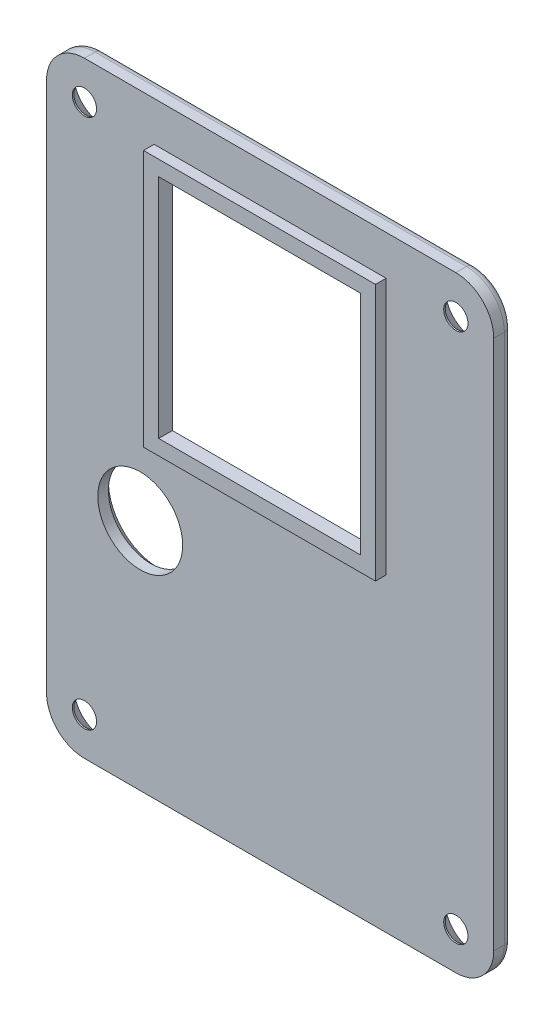
from build123d import *

# Parameters (mm, degrees)
SKETCH_1_W           = 59
SKETCH_1_H           = 80
SKETCH_1_R           = 5.6
EXTRUDE_1_DEPTH      = 2.4
SKETCH_4_W           = 59
SKETCH_4_H           = 80
EXTRUDE_6_DEPTH      = 5.5
FILLET_1_R           = 5
FILLET_2_R           = 5
SKETCH_14_R          = 3
SKETCH_14_R_2        = 1.3
EXTRUDE_7_DEPTH      = 6.5
EXTRUDE_10_DEPTH     = 1
FILLET_3_R           = 1
CUT_EXTRUDE_1_DEPTH  = 10
SKETCH_23_W          = 26.6
SKETCH_23_H          = 29.9
CUT_EXTRUDE_4_DEPTH  = 52
SKETCH_24_W          = 26.6
SKETCH_24_H          = 5
EXTRUDE_11_DEPTH     = 0.2
SKETCH_25_W          = 26.6
SKETCH_25_H          = 5
EXTRUDE_12_DEPTH     = 0.2
SKETCH_26_R          = 3.14740537
SKETCH_26_R_2        = 1.3
EXTRUDE_13_DEPTH     = 6.5
CUT_EXTRUDE_5_DEPTH  = 0.6
CHAMFER_1_SIZE       = 2
CHAMFER_2_SIZE       = 1
EXTRUDE_16_DEPTH     = 6.5
EXTRUDE_16_2_DEPTH   = 6.5
EXTRUDE_16_3_DEPTH   = 6.5
EXTRUDE_16_4_DEPTH   = 6.5
EXTRUDE_16_5_DEPTH   = 6.5
EXTRUDE_16_6_DEPTH   = 6.5
EXTRUDE_17_REACH     = 101.616
SKETCH_34_R          = 1.3
CUT_EXTRUDE_7_DEPTH  = 10
SKETCH_33_W          = 70.771509838
SKETCH_33_H          = 90.701063175
CUT_EXTRUDE_6_DEPTH  = 10
CHAMFER_3_SIZE       = 2.5
SKETCH_35_W          = 30.6
SKETCH_35_H          = 33.9
SKETCH_35_W_2        = 26.6
SKETCH_35_H_2        = 29.9
EXTRUDE_18_DEPTH     = 1.4
SKETCH_37_R          = 1.6
CUT_EXTRUDE_11_DEPTH = 11.4


with BuildPart() as part:
    # Эскиз1 → Бобышка-Вытянуть1 (new body)
    with BuildSketch(Plane.XY):
        with Locations((29.5, -40)):
            Rectangle(SKETCH_1_W, SKETCH_1_H)
        with Locations((12.36, -49.17)):
            Circle(SKETCH_1_R, mode=Mode.SUBTRACT)
    extrude(amount=EXTRUDE_1_DEPTH)

    # Эскиз4 → Бобышка-Вытянуть6 (add)
    with BuildSketch(Plane.XY.offset(2.4)):
        with Locations((29.5, -40)):
            Rectangle(SKETCH_4_W, SKETCH_4_H)
        with BuildLine():
            Line((5.1, -2), (53.9, -2))
            ThreePointArc((53.9, -2), (56.092031022, -2.907968978), (57, -5.1))
            Line((57, -5.1), (57, -74.9))
            ThreePointArc((57, -74.9), (56.092031022, -77.092031022), (53.9, -78))
            Line((53.9, -78), (5.1, -78))
            ThreePointArc((5.1, -78), (2.907968978, -77.092031022), (2, -74.9))
            Line((2, -74.9), (2, -5.1))
            ThreePointArc((2, -5.1), (2.907968978, -2.907968978), (5.1, -2))
        make_face(mode=Mode.SUBTRACT)
    extrude(amount=EXTRUDE_6_DEPTH)

    # Скругление1
    fillet_1_edges = [part.edges().sort_by_distance(p)[0] for p in [
        (0, 0, 3.95),
    ]]
    fillet(fillet_1_edges, radius=FILLET_1_R)

    # Скругление2
    fillet_2_edges = [part.edges().sort_by_distance(p)[0] for p in [
        (59, 0, 3.95),
        (59, -80, 3.95),
        (0, -80, 3.95),
    ]]
    fillet(fillet_2_edges, radius=FILLET_2_R)

    # Эскиз14 → Бобышка-Вытянуть7 (add)
    # profile 1 of 4: a face of its own
    with BuildSketch(Plane.XY.offset(2.4)):
        with Locations(Location((5, -5, 0), (0, 0, 180.947144451))):
            Circle(SKETCH_14_R)
        with Locations(Location((5, -5, 0), (0, 0, 180))):
            Circle(SKETCH_14_R_2, mode=Mode.SUBTRACT)
    # profile 2 of 4: a face of its own
    with BuildSketch(Plane.XY.offset(2.4)):
        with Locations(Location((5, -75, 0), (0, 0, 179.052855549))):
            Circle(SKETCH_14_R)
        with Locations(Location((5, -75, 0), (0, 0, 180))):
            Circle(SKETCH_14_R_2, mode=Mode.SUBTRACT)
    # profile 3 of 4: a face of its own
    with BuildSketch(Plane.XY.offset(2.4)):
        with Locations(Location((54, -75, 0), (0, 0, 269.052855549))):
            Circle(SKETCH_14_R)
        with Locations(Location((54, -75, 0), (0, 0, 180))):
            Circle(SKETCH_14_R_2, mode=Mode.SUBTRACT)
    # profile 4 of 4: a face of its own
    with BuildSketch(Plane.XY.offset(2.4)):
        with Locations(Location((54, -5, 0), (0, 0, 90.947144451))):
            Circle(SKETCH_14_R)
        with Locations(Location((54, -5, 0), (0, 0, 180))):
            Circle(SKETCH_14_R_2, mode=Mode.SUBTRACT)
    extrude(amount=EXTRUDE_7_DEPTH)

    # Скругление3
    fillet_3_edges = [part.edges().sort_by_distance(p)[0] for p in [
        (0, -40, 0),
        (1.464466094, -1.464466094, 0),
        (29.5, -80, 0),
        (29.5, 0, 0),
        (59, -40, 0),
        (57.535533906, -1.464466094, 0),
        (57.535533906, -78.535533906, 0),
        (1.464466094, -78.535533906, 0),
    ]]
    fillet(fillet_3_edges, radius=FILLET_3_R)


with BuildPart() as body_2:
    # Эскиз15 → Бобышка-Вытянуть10 (new body)
    with BuildSketch(Plane.XY.offset(7.9)):
        with BuildLine():
            Line((5, 0), (54, 0))
            ThreePointArc((54, 0), (57.535533906, -1.464466094), (59, -5))
            Line((59, -5), (59, -75))
            ThreePointArc((59, -75), (57.535533906, -78.535533906), (54, -80))
            Line((54, -80), (5, -80))
            ThreePointArc((5, -80), (1.464466094, -78.535533906), (0, -75))
            Line((0, -75), (0, -5))
            ThreePointArc((0, -5), (1.464466094, -1.464466094), (5, 0))
        make_face()
        with BuildLine():
            Line((5, -1), (54, -1))
            ThreePointArc((54, -1), (56.828427125, -2.171572875), (58, -5))
            Line((58, -5), (58, -75))
            ThreePointArc((58, -75), (56.828427125, -77.828427125), (54, -79))
            Line((54, -79), (5, -79))
            ThreePointArc((5, -79), (2.171572875, -77.828427125), (1, -75))
            Line((1, -75), (1, -5))
            ThreePointArc((1, -5), (2.171572875, -2.171572875), (5, -1))
        make_face(mode=Mode.SUBTRACT)
    extrude(amount=EXTRUDE_10_DEPTH)


with BuildPart() as cut_extrude_1_tool:
    # Эскиз20 → Вырез-Вытянуть1 (new body)
    with BuildSketch(Plane(origin=(59, 0, 0), x_dir=(0, 0, -1), z_dir=(1, 0, 0))):
        with BuildLine():
            Line((-8.9, -11.15), (-5.2, -11.15))
            ThreePointArc((-5.2, -11.15), (-4.492893219, -11.442893219), (-4.2, -12.15))
            Line((-4.2, -12.15), (-4.2, -18.25))
            ThreePointArc((-4.2, -18.25), (-4.492893219, -18.957106781), (-5.2, -19.25))
            Line((-5.2, -19.25), (-8.9, -19.25))
            Line((-8.9, -19.25), (-8.9, -11.15))
        make_face()
    extrude(amount=-CUT_EXTRUDE_1_DEPTH)


with BuildPart() as part_1:
    add(part.part)

    # Вырез-Вытянуть1: cut by cut_extrude_1_tool
    add(cut_extrude_1_tool.part, mode=Mode.SUBTRACT)

    # Эскиз23 → Вырез-Вытянуть4 (cut)
    with BuildSketch(Plane(origin=(0, 0, 0), x_dir=(-1, 0, 0), z_dir=(0, 0, -1))):
        with Locations((-29.500023272, -22.190991649)):
            Rectangle(SKETCH_23_W, SKETCH_23_H)
    extrude(amount=-CUT_EXTRUDE_4_DEPTH, mode=Mode.SUBTRACT)

    # Эскиз24 → Бобышка-Вытянуть11 (add)
    with BuildSketch(Plane.XY.offset(2.4)):
        with Locations((29.500023272, -4.740991649)):
            Rectangle(SKETCH_24_W, SKETCH_24_H)
    extrude(amount=EXTRUDE_11_DEPTH)

    # Эскиз25 → Бобышка-Вытянуть12 (add)
    with BuildSketch(Plane.XY.offset(2.4)):
        with Locations((29.500023272, -39.640991649)):
            Rectangle(SKETCH_25_W, SKETCH_25_H)
    extrude(amount=EXTRUDE_12_DEPTH)


with BuildPart() as body_2_1:
    add(body_2.part)

    # Вырез-Вытянуть1: cut by cut_extrude_1_tool
    add(cut_extrude_1_tool.part, mode=Mode.SUBTRACT)


    add(part_1.part)  # Бобышка-Вытянуть13 merges part
    # Эскиз26 → Бобышка-Вытянуть13 (add)
    with BuildSketch(Plane.XY.offset(2.4)):
        with Locations(Location((46.9, -5.7, 0), (0, 0, 180))):
            Circle(SKETCH_26_R)
        with Locations(Location((46.9, -5.7, 0), (0, 0, 180))):
            Circle(SKETCH_26_R_2, mode=Mode.SUBTRACT)
    extrude(amount=EXTRUDE_13_DEPTH)

    # Эскиз27 → Вырез-Вытянуть5 (cut)
    with BuildSketch(Plane.XY.offset(7.9)):
        with BuildLine():
            Line((58, -75), (58, -19.25))
            Line((58, -19.25), (57, -19.25))
            Line((57, -19.25), (57, -74.9))
            ThreePointArc((57, -74.9), (56.999897526, -74.925205779), (56.999590109, -74.950409891))
            ThreePointArc((56.999590109, -74.950409891), (56.121320344, -77.121320344), (53.950409891, -77.999590109))
            ThreePointArc((53.950409891, -77.999590109), (53.925205779, -77.999897526), (53.9, -78))
            Line((53.9, -78), (5.1, -78))
            ThreePointArc((5.1, -78), (5.074794221, -77.999897526), (5.049590109, -77.999590109))
            ThreePointArc((5.049590109, -77.999590109), (2.878679656, -77.121320344), (2.000409891, -74.950409891))
            ThreePointArc((2.000409891, -74.950409891), (2.000102474, -74.925205779), (2, -74.9))
            Line((2, -74.9), (2, -5.1))
            ThreePointArc((2, -5.1), (2.000102474, -5.074794221), (2.000409891, -5.049590109))
            ThreePointArc((2.000409891, -5.049590109), (2.878679656, -2.878679656), (5.049590109, -2.000409891))
            ThreePointArc((5.049590109, -2.000409891), (5.074794221, -2.000102474), (5.1, -2))
            Line((5.1, -2), (53.9, -2))
            ThreePointArc((53.9, -2), (53.925205779, -2.000102474), (53.950409891, -2.000409891))
            ThreePointArc((53.950409891, -2.000409891), (56.121320344, -2.878679656), (56.999590109, -5.049590109))
            ThreePointArc((56.999590109, -5.049590109), (56.999897526, -5.074794221), (57, -5.1))
            Line((57, -5.1), (57, -11.15))
            Line((57, -11.15), (58, -11.15))
            Line((58, -11.15), (58, -5))
            ThreePointArc((58, -5), (56.828427125, -2.171572875), (54, -1))
            Line((54, -1), (5, -1))
            ThreePointArc((5, -1), (2.171572875, -2.171572875), (1, -5))
            Line((1, -5), (1, -75))
            ThreePointArc((1, -75), (2.171572875, -77.828427125), (5, -79))
            Line((5, -79), (54, -79))
            ThreePointArc((54, -79), (56.828427125, -77.828427125), (58, -75))
        make_face()
    extrude(amount=-CUT_EXTRUDE_5_DEPTH, mode=Mode.SUBTRACT)

    # Фаска1
    chamfer_1_edges = [body_2_1.edges().sort_by_distance(p)[0] for p in [
        (16.200023272, -22.190991649, 0),
        (29.500023272, -37.140991649, 0),
        (42.800023272, -22.190991649, 0),
        (29.500023272, -7.240991649, 0),
    ]]
    chamfer(chamfer_1_edges, length=CHAMFER_1_SIZE)

    # Фаска2
    chamfer_2_edges = [body_2_1.edges().sort_by_distance(p)[0] for p in [
        (6.76, -49.17, 0),
    ]]
    chamfer(chamfer_2_edges, length=CHAMFER_2_SIZE)

    # Бобышка-Вытянуть17: up to this face of the body (flat: up to its plane)
    extrude_17_end = Plane(body_2_1.part.faces().sort_by_distance((49.958383303, -5.7, 8.9))[0])
    # Эскиз31 → Бобышка-Вытянуть17 (add, up to the picked face)
    with BuildSketch(Plane.XY.offset(2.4), mode=Mode.PRIVATE) as extrude_17_sk1:
        Polygon((5, -2), (8, -2), (8, -5), align=None)
    extrude_17_tool1 = split(extrude(extrude_17_sk1.sketch, amount=EXTRUDE_17_REACH, mode=Mode.PRIVATE), bisect_by=extrude_17_end, keep=Keep.BOTH, mode=Mode.PRIVATE)
    # Эскиз31 → Бобышка-Вытянуть17 (add, up to the picked face)
    with BuildSketch(Plane.XY.offset(2.4), mode=Mode.PRIVATE) as extrude_17_sk2:
        Polygon((5, -8), (2, -8), (2, -5.1), align=None)
    extrude_17_tool2 = split(extrude(extrude_17_sk2.sketch, amount=EXTRUDE_17_REACH, mode=Mode.PRIVATE), bisect_by=extrude_17_end, keep=Keep.BOTH, mode=Mode.PRIVATE)
    # Эскиз31 → Бобышка-Вытянуть17 (add, up to the picked face)
    with BuildSketch(Plane.XY.offset(2.4), mode=Mode.PRIVATE) as extrude_17_sk3:
        Polygon((50.04740537, -5.7), (50.04740537, -2), (43.75259463, -2), (43.753891914, -5.790357503), (46.9, -2.55259463), align=None)
    extrude_17_tool3 = split(extrude(extrude_17_sk3.sketch, amount=EXTRUDE_17_REACH, mode=Mode.PRIVATE), bisect_by=extrude_17_end, keep=Keep.BOTH, mode=Mode.PRIVATE)
    # Эскиз31 → Бобышка-Вытянуть17 (add, up to the picked face)
    with BuildSketch(Plane.XY.offset(2.4), mode=Mode.PRIVATE) as extrude_17_sk4:
        Polygon((57, -5), (54, -8), (57, -8), align=None)
    extrude_17_tool4 = split(extrude(extrude_17_sk4.sketch, amount=EXTRUDE_17_REACH, mode=Mode.PRIVATE), bisect_by=extrude_17_end, keep=Keep.BOTH, mode=Mode.PRIVATE)
    # Эскиз31 → Бобышка-Вытянуть17 (add, up to the picked face)
    with BuildSketch(Plane.XY.offset(2.4), mode=Mode.PRIVATE) as extrude_17_sk5:
        Polygon((54, -2), (51, -2), (51, -5), align=None)
    extrude_17_tool5 = split(extrude(extrude_17_sk5.sketch, amount=EXTRUDE_17_REACH, mode=Mode.PRIVATE), bisect_by=extrude_17_end, keep=Keep.BOTH, mode=Mode.PRIVATE)
    add(extrude_17_tool1.solids().sort_by(Axis((7, -3, 2.4), (0, 0, 1)))[0])
    add(extrude_17_tool2.solids().sort_by(Axis((3, -7.033333, 2.4), (0, 0, 1)))[0])
    add(extrude_17_tool3.solids().sort_by(Axis((49.973926, -3.85, 2.4), (0, 0, 1)))[0])
    add(extrude_17_tool4.solids().sort_by(Axis((56, -7, 2.4), (0, 0, 1)))[0])
    add(extrude_17_tool5.solids().sort_by(Axis((52, -3, 2.4), (0, 0, 1)))[0])

    # Эскиз34 → Вырез-Вытянуть7 (cut)
    with BuildSketch(Plane.XY.offset(8.9)):
        with Locations(Location((5, -75, 0), (0, 0, 180))):
            Circle(SKETCH_34_R)
        with Locations(Location((54, -75, 0), (0, 0, 180))):
            Circle(SKETCH_34_R)
        with Locations(Location((54, -5, 0), (0, 0, 180))):
            Circle(SKETCH_34_R)
        with Locations(Location((5, -5, 0), (0, 0, 180))):
            Circle(SKETCH_34_R)
    extrude(amount=-CUT_EXTRUDE_7_DEPTH, mode=Mode.SUBTRACT)


with BuildPart() as body_2_2:
    # Эскиз30 → Бобышка-Вытянуть16 (new body)
    with BuildSketch(Plane.XY.offset(2.4)):
        with BuildLine():
            Line((5.049590109, -77.999590109), (8, -78))
            Line((8, -78), (8, -75))
            ThreePointArc((8, -75), (7.138781233, -77.103714533), (5.049590109, -77.999590109))
        make_face()
    extrude(amount=EXTRUDE_16_DEPTH)


with BuildPart() as body_3:
    # Эскиз30 → Extrude 16 2 (new body)
    with BuildSketch(Plane.XY.offset(2.4)):
        with BuildLine():
            ThreePointArc((5, -72), (7.121320344, -72.878679656), (8, -75))
            Line((8, -75), (8, -72))
            Line((8, -72), (5, -72))
        make_face()
    extrude(amount=EXTRUDE_16_2_DEPTH)


with BuildPart() as body_4:
    # Эскиз30 → Extrude 16 3 (new body)
    with BuildSketch(Plane.XY.offset(2.4)):
        with BuildLine():
            ThreePointArc((2.000409891, -74.950409891), (2.896285467, -72.861218767), (5, -72))
            Line((5, -72), (2, -72))
            Line((2, -72), (2.000409891, -74.950409891))
        make_face()
    extrude(amount=EXTRUDE_16_3_DEPTH)


with BuildPart() as body_5:
    # Эскиз30 → Extrude 16 4 (new body)
    with BuildSketch(Plane.XY.offset(2.4)):
        with BuildLine():
            Line((57, -72), (54, -72))
            ThreePointArc((54, -72), (56.103714533, -72.861218767), (56.999590109, -74.950409891))
            ThreePointArc((56.999590109, -74.950409891), (56.999897526, -74.925205779), (57, -74.9))
            Line((57, -74.9), (57, -72))
        make_face()
    extrude(amount=EXTRUDE_16_4_DEPTH)


with BuildPart() as body_6:
    # Эскиз30 → Extrude 16 5 (new body)
    with BuildSketch(Plane.XY.offset(2.4)):
        with BuildLine():
            ThreePointArc((51, -75), (51.878679656, -72.878679656), (54, -72))
            Line((54, -72), (51, -72))
            Line((51, -72), (51, -75))
        make_face()
    extrude(amount=EXTRUDE_16_5_DEPTH)


with BuildPart() as body_7:
    # Эскиз30 → Extrude 16 6 (new body)
    with BuildSketch(Plane.XY.offset(2.4)):
        with BuildLine():
            ThreePointArc((53.950409891, -77.999590109), (51.861218767, -77.103714533), (51, -75))
            Line((51, -75), (51, -78))
            Line((51, -78), (53.9, -78))
            ThreePointArc((53.9, -78), (53.925205779, -77.999897526), (53.950409891, -77.999590109))
        make_face()
    extrude(amount=EXTRUDE_16_6_DEPTH)


with BuildPart() as cut_extrude_6_tool:
    # Эскиз33 → Вырез-Вытянуть6 (new body)
    with BuildSketch(Plane.XY.offset(2.4)):
        with Locations((30.732946322, -41.484926606)):
            Rectangle(SKETCH_33_W, SKETCH_33_H)
    extrude(amount=CUT_EXTRUDE_6_DEPTH)


with BuildPart() as body_2_3:
    add(body_2_1.part)

    # Вырез-Вытянуть6: cut by cut_extrude_6_tool
    add(cut_extrude_6_tool.part, mode=Mode.SUBTRACT)

    # Фаска3
    # the kernel refuses this chamfer: 2.5 mm, written as the material it takes off along each edge
    with BuildSketch(Plane(origin=(5, -5, 0), x_dir=(-1, 0, 0), z_dir=(0, 1, 0))) as chamfer_3_piece_1:
        Polygon((1.3 + CHAMFER_3_SIZE, 0), (1.3, CHAMFER_3_SIZE), (1.3, 0), align=None)
    revolve(axis=Axis((5, -5, 0), (0, 0, 1)), mode=Mode.SUBTRACT)
    with BuildSketch(Plane(origin=(5, -75, 0), x_dir=(-1, 0, 0), z_dir=(0, 1, 0))) as chamfer_3_piece_2:
        Polygon((1.3 + CHAMFER_3_SIZE, 0), (1.3, CHAMFER_3_SIZE), (1.3, 0), align=None)
    revolve(axis=Axis((5, -75, 0), (0, 0, 1)), mode=Mode.SUBTRACT)
    with BuildSketch(Plane(origin=(54, -75, 0), x_dir=(-1, 0, 0), z_dir=(0, 1, 0))) as chamfer_3_piece_3:
        Polygon((1.3 + CHAMFER_3_SIZE, 0), (1.3, CHAMFER_3_SIZE), (1.3, 0), align=None)
    revolve(axis=Axis((54, -75, 0), (0, 0, 1)), mode=Mode.SUBTRACT)
    with BuildSketch(Plane(origin=(54, -5, 0), x_dir=(-1, 0, 0), z_dir=(0, 1, 0))) as chamfer_3_piece_4:
        Polygon((1.3 + CHAMFER_3_SIZE, 0), (1.3, CHAMFER_3_SIZE), (1.3, 0), align=None)
    revolve(axis=Axis((54, -5, 0), (0, 0, 1)), mode=Mode.SUBTRACT)

    # Эскиз35 → Бобышка-Вытянуть18 (add)
    with BuildSketch(Plane.XY.offset(2.4)):
        with Locations((29.500023272, -22.190991649)):
            Rectangle(SKETCH_35_W, SKETCH_35_H)
        with Locations((29.500023272, -22.190991649)):
            Rectangle(SKETCH_35_W_2, SKETCH_35_H_2, mode=Mode.SUBTRACT)
    extrude(amount=EXTRUDE_18_DEPTH)

    # Эскиз37 → Вырез-Вытянуть11 (cut)
    with BuildSketch(Plane.XY.offset(2.4)):
        with Locations((5, -5)):
            Circle(SKETCH_37_R)
        with Locations((54, -5)):
            Circle(SKETCH_37_R)
        with Locations((54, -75)):
            Circle(SKETCH_37_R)
        with Locations((5, -75)):
            Circle(SKETCH_37_R)
    extrude(amount=-CUT_EXTRUDE_11_DEPTH, mode=Mode.SUBTRACT)


with BuildPart() as body_2_2_1:
    add(body_2_2.part)

    # Вырез-Вытянуть6: cut by cut_extrude_6_tool
    add(cut_extrude_6_tool.part, mode=Mode.SUBTRACT)


with BuildPart() as body_3_1:
    add(body_3.part)

    # Вырез-Вытянуть6: cut by cut_extrude_6_tool
    add(cut_extrude_6_tool.part, mode=Mode.SUBTRACT)


with BuildPart() as body_4_1:
    add(body_4.part)

    # Вырез-Вытянуть6: cut by cut_extrude_6_tool
    add(cut_extrude_6_tool.part, mode=Mode.SUBTRACT)


with BuildPart() as body_5_1:
    add(body_5.part)

    # Вырез-Вытянуть6: cut by cut_extrude_6_tool
    add(cut_extrude_6_tool.part, mode=Mode.SUBTRACT)


with BuildPart() as body_6_1:
    add(body_6.part)

    # Вырез-Вытянуть6: cut by cut_extrude_6_tool
    add(cut_extrude_6_tool.part, mode=Mode.SUBTRACT)


with BuildPart() as body_7_1:
    add(body_7.part)

    # Вырез-Вытянуть6: cut by cut_extrude_6_tool
    add(cut_extrude_6_tool.part, mode=Mode.SUBTRACT)


solid = body_2_3.part
